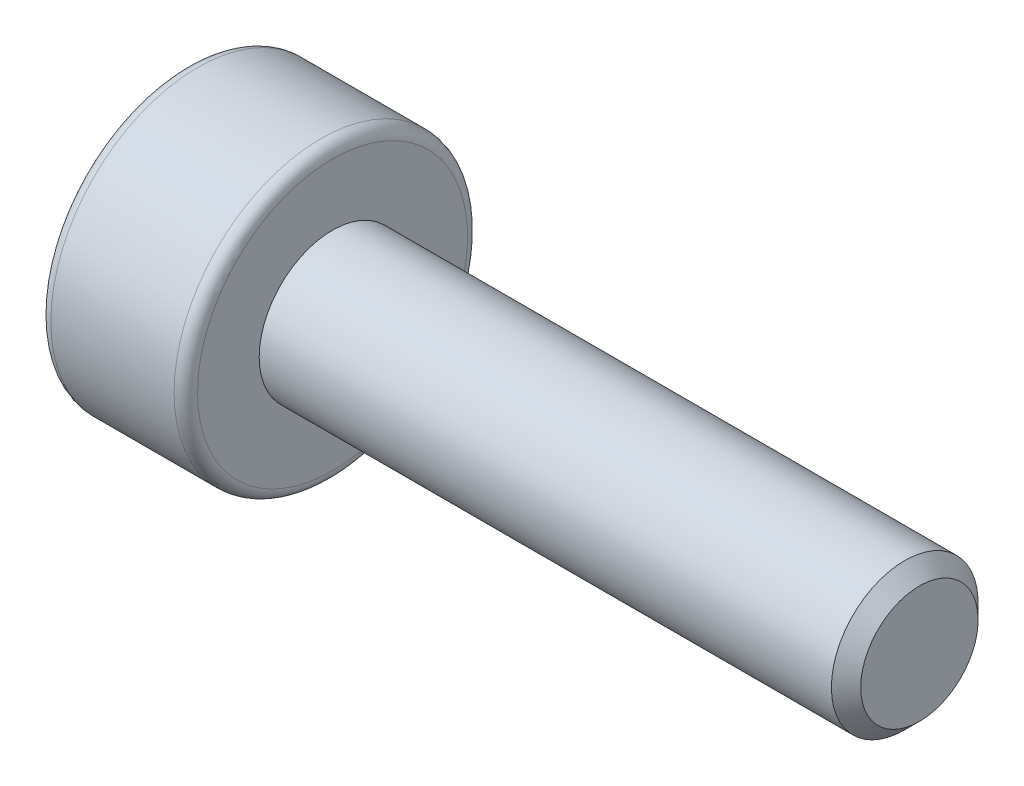
from build123d import *

# Parameters (mm, degrees)
CUT_EXTRUDE1_DEPTH = 0.8


with BuildPart() as part:
    # Sketch2 → Revolve1 (revolve)
    with BuildSketch(Plane.XY):
        with BuildLine():
            Line((0, 0), (0, 2.3))
            ThreePointArc((0, 2.3), (0.058578644, 2.441421356), (0.2, 2.5))
            Line((0.2, 2.5), (2.3, 2.5))
            ThreePointArc((2.3, 2.5), (2.441421356, 2.441421356), (2.5, 2.3))
            Line((2.5, 2.3), (2.5, 1.25))
            Line((2.5, 1.25), (12.25, 1.25))
            Line((12.25, 1.25), (12.5, 1))
            Line((12.5, 1), (12.5, 0))
            Line((12.5, 0), (0, 0))
        make_face()
    revolve(axis=Axis((-2.281841559, 0, 0), (1, 0, 0)))

    # Sketch3 → Cut-Extrude1 (cut)
    with BuildSketch(Plane.ZY):
        Polygon((0.577350269, -1), (1.154700538, 0), (0.577350269, 1), (-0.577350269, 1), (-1.154700538, 0), (-0.577350269, -1), align=None)
    extrude(amount=-CUT_EXTRUDE1_DEPTH, mode=Mode.SUBTRACT)


solid = part.part
